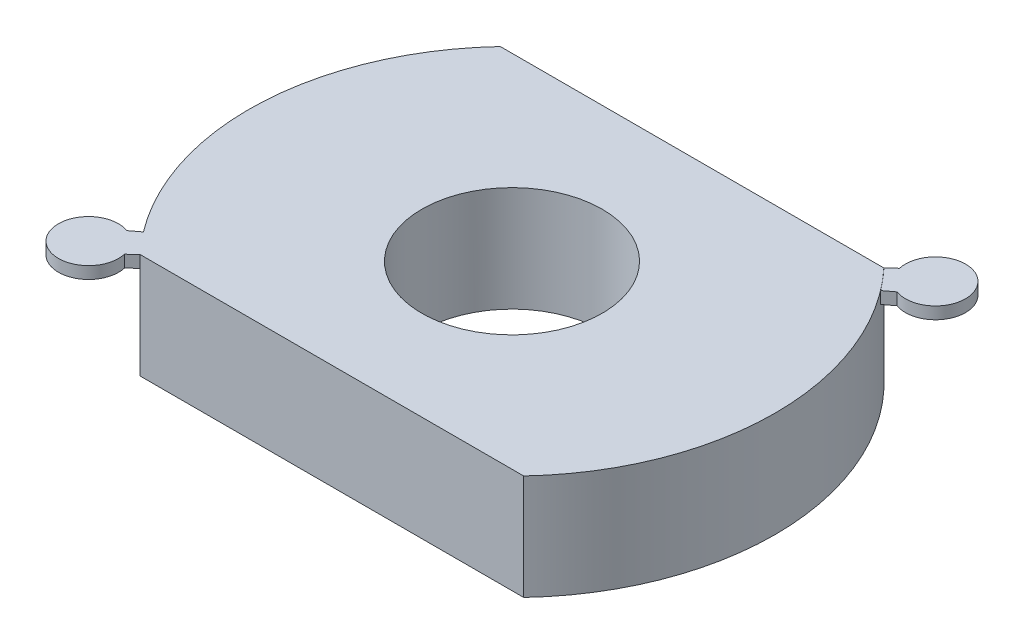
from build123d import *

# Parameters (mm, degrees)
SKETCH1_R                = 1750
BOSS_EXTRUDE1_DEPTH      = 700
CUT_EXTRUDE10_DEPTH      = 2572.964229922
CUT_EXTRUDE10_DEPTH_BACK = 2572.964229922
SKETCH9_W                = 5273.235769222
SKETCH9_H                = 4165.824449254
SKETCH9_W_2              = 4212.623718326
SKETCH9_H_2              = 2396.11984
CUT_EXTRUDE3_DEPTH       = 2234.348958831
CUT_EXTRUDE3_DEPTH_BACK  = 2234.348958831
SKETCH3_R                = 600
SHELL1_T                 = -1.5
BOSS_EXTRUDE2_START      = -80
BOSS_EXTRUDE2_DEPTH      = 80
BOSS_EXTRUDE3_DEPTH      = 80


with BuildPart() as part:
    # Sketch1 → Boss-Extrude1 (new body)
    with BuildSketch(Plane(origin=(0, 0, 0), x_dir=(1, 0, 0), z_dir=(0, 1, 0))):
        Circle(SKETCH1_R)
    extrude(amount=BOSS_EXTRUDE1_DEPTH)

    # Sketch9 → Cut-Extrude10 (cut, two sides: drawn at the far end of the back side and taken through both)
    with BuildSketch(Plane.XZ.offset(-CUT_EXTRUDE10_DEPTH_BACK)):
        Rectangle(SKETCH9_W, SKETCH9_H)
        Rectangle(SKETCH9_W_2, SKETCH9_H_2, mode=Mode.SUBTRACT)
    extrude(amount=CUT_EXTRUDE10_DEPTH + CUT_EXTRUDE10_DEPTH_BACK, mode=Mode.SUBTRACT)

    # Sketch3 → Cut-Extrude3 (cut, two sides: drawn at the far end of the back side and taken through both)
    with BuildSketch(Plane.XZ.offset(-CUT_EXTRUDE3_DEPTH_BACK)):
        Circle(SKETCH3_R)
    extrude(amount=CUT_EXTRUDE3_DEPTH + CUT_EXTRUDE3_DEPTH_BACK, mode=Mode.SUBTRACT)

    # Shell1
    shell1_openings = [part.faces().sort_by_distance(p)[0] for p in [
        (1707.583740986, 0, 0),
    ]]
    offset(amount=SHELL1_T, openings=shell1_openings, kind=Kind.INTERSECTION)

    # Sketch12 → Boss-Extrude2 (add)
    with BuildSketch(Plane(origin=(0, 700, 0), x_dir=(1, 0, 0), z_dir=(0, 1, 0)).offset(BOSS_EXTRUDE2_START)):
        with BuildLine():
            Line((-1329.427366657, -1248.362496346), (-1275.720428066, -1197.93046101))
            ThreePointArc((-1275.720428066, -1197.93046101), (-1337.090701529, -1129.021016582), (-1394.743394808, -1056.972498526))
            Line((-1394.743394808, -1056.972498526), (-1456.886660309, -1104.066267063))
            ThreePointArc((-1456.886660309, -1104.066267063), (-1674.443216413, -1424.679230146), (-1329.427366657, -1248.362496346))
        make_face()
    extrude(amount=BOSS_EXTRUDE2_DEPTH)


with BuildPart() as body_2:
    # Sketch12<6> → Boss-Extrude3 (new body)
    with BuildSketch(Plane(origin=(0, 700, 0), x_dir=(1, 0, 0), z_dir=(0, 1, 0))):
        with BuildLine():
            Line((1329.427366657, 1248.362496346), (1275.858293729, 1198.05992))
            ThreePointArc((1275.858293729, 1198.05992), (1337.197472539, 1129.114373304), (1394.743394808, 1056.972498526))
            Line((1394.743394808, 1056.972498526), (1456.886660309, 1104.066267063))
            ThreePointArc((1456.886660309, 1104.066267063), (1674.443216413, 1424.679230146), (1329.427366657, 1248.362496346))
        make_face()
    extrude(amount=-BOSS_EXTRUDE3_DEPTH)


solid = Compound([part.part, body_2.part])
